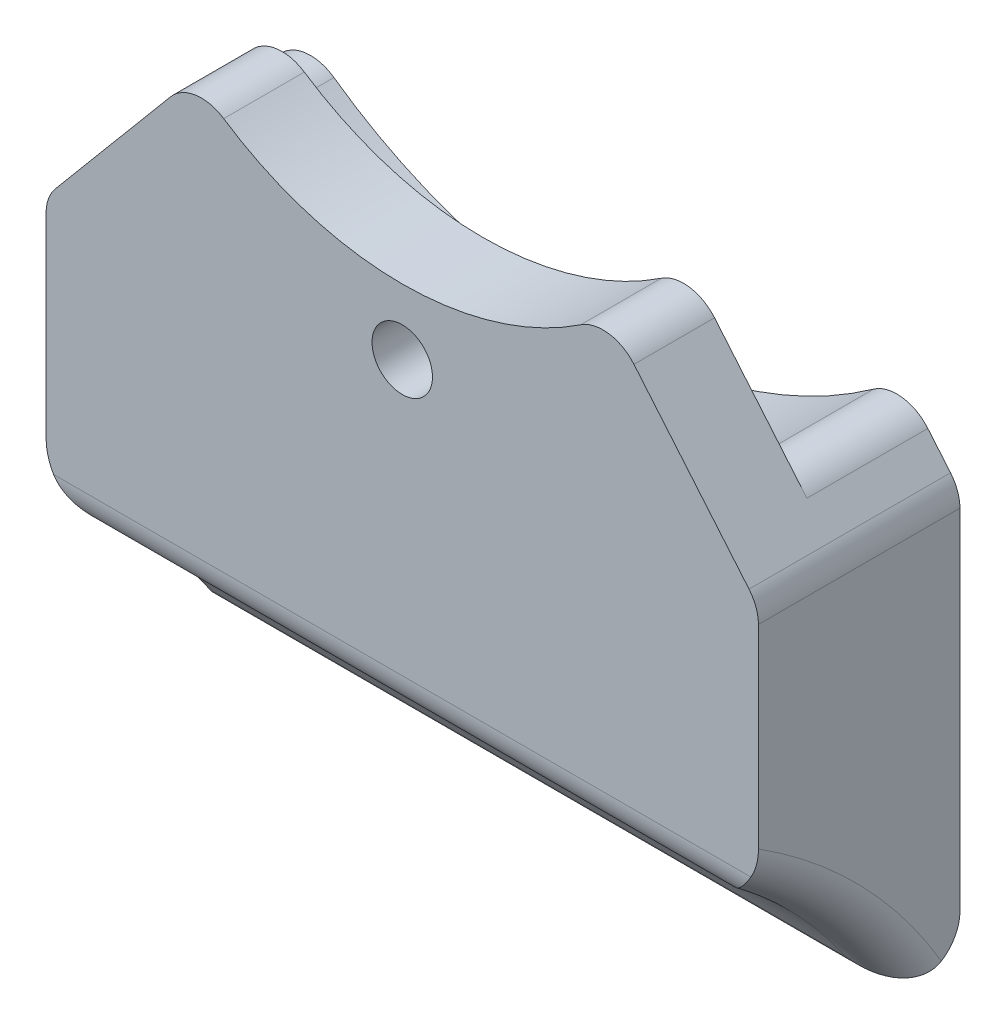
from build123d import *

# Parameters (mm, degrees)
SKETCH_1_R          = 1.5
EXTRUDE_1_DEPTH     = 4
EXTRUDE_START       = -10
EXTRUDE_2_DEPTH     = 10
EXTRUDE_3_DEPTH     = 10
CUT_EXTRUDE_1_DEPTH = 63.39884758235035
FILLET_1_R          = 2


with BuildPart() as part:
    # 草图1 → 凸台-拉伸1 (new body)
    with BuildSketch(Plane.XY):
        with BuildLine():
            ThreePointArc((10.284601754984648, -12.256711089903634), (1.78e-15, -16), (-10.284601754984646, -12.256711089903636))
            Line((-10.284601754984646, -12.25671108990364), (-14.848393783759084, -17.69562663604838))
            ThreePointArc((-14.848393783759082, -17.695626636048377), (1.78e-15, -23.10000000000001), (14.848393783759082, -17.695626636048374))
            Line((14.848393783759088, -17.695626636048377), (10.28460175498465, -12.256711089903638))
        make_face()
        with Locations((-1.05e-15, -19.25)):
            Circle(SKETCH_1_R, mode=Mode.SUBTRACT)
    extrude(amount=EXTRUDE_1_DEPTH)

    # 草图3 → 凸台-拉伸2 (add)
    with BuildSketch(Plane.XY.offset(4).offset(EXTRUDE_START)):
        with BuildLine():
            ThreePointArc((14.848393783759091, -17.695626636048377), (3.55e-15, -23.100000000000012), (-14.848393783759086, -17.69562663604838))
            Line((-14.848393783759084, -17.69562663604838), (-17.676659266379858, -21.066222185771874))
            ThreePointArc((-17.676659266379858, -21.066222185771878), (-5.05e-15, -27.5), (17.676659266379847, -21.066222185771885))
            Line((17.67665926637986, -21.066222185771874), (14.84839378375909, -17.695626636048377))
        make_face()
    extrude(amount=EXTRUDE_2_DEPTH)

    # 草图4 → 凸台-拉伸3 (add)
    with BuildSketch(Plane.XY.offset(4).offset(EXTRUDE_START)):
        with BuildLine():
            ThreePointArc((17.676659266379865, -21.066222185771874), (5.33e-15, -27.500000000000004), (-17.67665926637986, -21.06622218577188))
            Line((-17.676659266379858, -21.066222185771878), (-17.676659266379854, -51.06622218577187))
            Line((-17.676659266379854, -51.06622218577187), (17.67665926637986, -51.06622218577187))
            Line((17.67665926637986, -51.06622218577187), (17.67665926637986, -21.066222185771874))
        make_face()
    extrude(amount=EXTRUDE_3_DEPTH)

    # 草图7 → 切除-拉伸1 (cut, through all)
    with BuildSketch(Plane(origin=(17.67665926637986, 0, 0), x_dir=(0, 0, -1), z_dir=(1, 0, 0))):
        with BuildLine():
            ThreePointArc((6.000000000000007, -48.061948520874864), (2.2370132097993825, -40.08558626713158), (-3.9999999999999964, -33.850035721513905))
            Line((-4, -33.850035721513905), (-4, -51.06622218577187))
            Line((-4, -51.06622218577187), (6, -51.06622218577187))
            Line((6, -51.06622218577187), (6, -48.061948520874864))
        make_face()
    extrude(amount=-CUT_EXTRUDE_1_DEPTH, mode=Mode.SUBTRACT)

    # 圆角1
    fillet_1_edges = [part.edges().sort_by_distance(p)[0] for p in [
        (14.848393783759091, -17.69562663604838, -3),
        (-14.848393783759086, -17.69562663604838, -3),
        (-17.676659266379858, -21.066222185771878, -1),
        (10.28460175498465, -12.256711089903636, 2),
        (17.676659266379858, -21.066222185771885, -1),
        (-10.284601754984646, -12.25671108990364, 2),
        (3.55e-15, -48.061948520874864, -6.000000000000005),
        (-17.676659266379854, -40.08558626713159, -2.2370132097993825),
        (3.55e-15, -33.850035721513905, 3.9999999999999973),
        (17.67665926637986, -40.08558626713159, -2.2370132097993825),
    ]]
    fillet(fillet_1_edges, radius=FILLET_1_R)


solid = part.part
